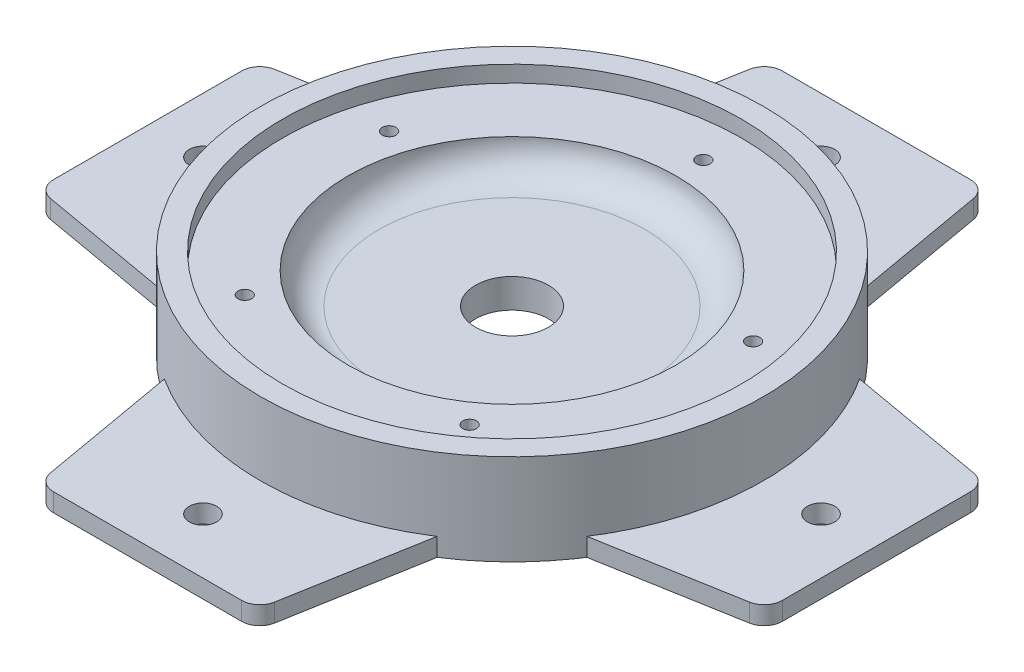
from build123d import *

# Parameters (mm, degrees)
F_3_16_0_1865_DIAMETER_HOLE1_AT_2_COUNT = 2
F_3_16_0_1865_DIAMETER_HOLE1_AT_2_PITCH = 181.676687383
CIRPATTERN2_COUNT                       = 5
F_1_1_DIAMETER_HOLE1_D                  = 25.4
BOSS_EXTRUDE1_DEPTH                     = 6.35
FILLET2_R                               = 6.35
CIRPATTERN4_COUNT                       = 4
FILLET3_R                               = 10.795


with BuildPart() as part:
    # Sketch1 → Revolve1 (revolve)
    with BuildSketch(Plane.XY, mode=Mode.PRIVATE) as revolve1_sk:
        Polygon((87.63, -5.08), (87.63, 26.67), (79.9719, 26.67), (79.9719, 20.955), (57.15, 20.955), (57.15, 10.16), (0, 10.16), (0, 0), (57.15, 0), (57.15, -5.08), align=None)
    revolve(revolve1_sk.sketch.rotate(Axis((0, 92.596818824, 0), (0, -1, 0)), 90), axis=Axis((0, 92.596818824, 0), (0, -1, 0)))

    # Sketch6 → 3/16 (0.1865) Diameter Hole1 (revolve, cut)
    with BuildSketch(Plane(origin=(0, 26.67, -66.675), x_dir=(0, 0, 1), z_dir=(1, 0, 0))):
        Polygon((0, 0), (0, 11.075168419), (2.36855, 9.652), (2.36855, 0), align=None)
    f_3_16_0_1865_diameter_hole1 = revolve(axis=Axis((0, 33.02, -66.675), (0, -1, 0)), mode=Mode.SUBTRACT)

    # 3/16 (0.1865) Diameter Hole1 at 2: 3/16 (0.1865) Diameter Hole1 ×2
    with Locations(*[Vector(-0.6277965872660483, 0, 0.778377443800309) * (i * F_3_16_0_1865_DIAMETER_HOLE1_AT_2_PITCH) for i in range(1, F_3_16_0_1865_DIAMETER_HOLE1_AT_2_COUNT)]):
        add(f_3_16_0_1865_diameter_hole1, mode=Mode.SUBTRACT)

    # CirPattern2: 3/16 (0.1865) Diameter Hole1 ×5 about axis
    cirpattern2_axis = Axis((0, 0, 0), (0, 1, 0))
    for i in range(1, CIRPATTERN2_COUNT):
        add(f_3_16_0_1865_diameter_hole1.rotate(cirpattern2_axis, i * 360 / CIRPATTERN2_COUNT), mode=Mode.SUBTRACT)

    # CirPattern2 copy 1 sketch → CirPattern2 copy 1 (revolve, cut)
    with BuildSketch(Plane(origin=(35.834852053, 26.67, 131.569029239), x_dir=(0.9510565162951535, 0, 0.30901699437494745), z_dir=(0.30901699437494745, 0, -0.9510565162951535))):
        Polygon((0, 0), (0, 11.075168419), (2.36855, 9.652), (2.36855, 0), align=None)
    revolve(axis=Axis((35.834852053, 33.02, 131.569029239), (0, -1, 0)), mode=Mode.SUBTRACT)

    # CirPattern2 copy 2 sketch → CirPattern2 copy 2 (revolve, cut)
    with BuildSketch(Plane(origin=(136.203160876, 26.67, 6.576096413), x_dir=(0.5877852522924732, 0, -0.8090169943749473), z_dir=(-0.8090169943749473, 0, -0.5877852522924732))):
        Polygon((0, 0), (0, 11.075168419), (2.36855, 9.652), (2.36855, 0), align=None)
    revolve(axis=Axis((136.203160876, 33.02, 6.576096413), (0, -1, 0)), mode=Mode.SUBTRACT)

    # CirPattern2 copy 3 sketch → CirPattern2 copy 3 (revolve, cut)
    with BuildSketch(Plane(origin=(48.343330743, 26.67, -127.504778142), x_dir=(-0.587785252292473, 0, -0.8090169943749476), z_dir=(-0.8090169943749476, 0, 0.587785252292473))):
        Polygon((0, 0), (0, 11.075168419), (2.36855, 9.652), (2.36855, 0), align=None)
    revolve(axis=Axis((48.343330743, 33.02, -127.504778142), (0, -1, 0)), mode=Mode.SUBTRACT)

    # CirPattern2 copy 4 sketch → CirPattern2 copy 4 (revolve, cut)
    with BuildSketch(Plane(origin=(-106.325339347, 26.67, -85.378383033), x_dir=(-0.9510565162951536, 0, 0.30901699437494723), z_dir=(0.30901699437494723, 0, 0.9510565162951536))):
        Polygon((0, 0), (0, 11.075168419), (2.36855, 9.652), (2.36855, 0), align=None)
    revolve(axis=Axis((-106.325339347, 33.02, -85.378383033), (0, -1, 0)), mode=Mode.SUBTRACT)

    # 1 (1) Diameter Hole1 (through all)
    with Locations(Plane(origin=(0, 10.16, 0), x_dir=(1, 0, 0), z_dir=(0, 1, 0))):
        with Locations((0, 0)):
            Hole(F_1_1_DIAMETER_HOLE1_D / 2)

    # Fillet3
    # the kernel refuses this fillet: 10.795 mm, written as the material it adds along each edge
    with BuildSketch(Plane(origin=(0, 10.16, 0), x_dir=(0, 0, 1), z_dir=(1, 0, 0))) as fillet3_piece_1:
        with BuildLine():
            CenterArc((57.15 - FILLET3_R, -FILLET3_R), FILLET3_R, 0, 90)
            Line((57.15 - FILLET3_R, 0), (57.15 - FILLET3_R, FILLET3_R * 0.02))
            Line((57.15 - FILLET3_R, FILLET3_R * 0.02), (57.15 + FILLET3_R * 0.02, FILLET3_R * 0.02))
            Line((57.15 + FILLET3_R * 0.02, FILLET3_R * 0.02), (57.15 + FILLET3_R * 0.02, -FILLET3_R))
            Line((57.15 + FILLET3_R * 0.02, -FILLET3_R), (57.15, -FILLET3_R))
        make_face()
    revolve(axis=Axis((0, 10.16, 0), (0, -1, 0)))
    with BuildSketch(Plane(origin=(0, 0, 0), x_dir=(0, 0, 1), z_dir=(1, 0, 0))) as fillet3_piece_2:
        with BuildLine():
            CenterArc((47.99189976, 10.795), FILLET3_R, 270, 58.034281249)
            Line((47.99189976, 0), (47.99189976, -0.2159))
            Line((47.99189976, -0.2159), (57.15, -0.2159))
            Line((57.15, -0.2159), (57.3659, 0))
            ThreePointArc((57.3659, 0), (57.3659, 2.54), (57.333162005, 4.9657))
            Line((57.333162005, 4.9657), (57.15, 5.08))
        make_face()
    revolve(axis=Axis((0, 0, 0), (0, -1, 0)))


with BuildPart() as body_2:
    # Sketch15 → Boss-Extrude1 (new body)
    with BuildSketch(Plane.XZ.offset(5.08)):
        with BuildLine():
            Line((-127, -38.1), (-73.632954963, -47.510049921))
            ThreePointArc((-73.632954963, -47.510049921), (-87.63, 0), (-73.632954963, 47.510049921))
            Line((-73.632954963, 47.510049921), (-127, 38.1))
            Line((-127, 38.1), (-127, -38.1))
        make_face()
    extrude(amount=-BOSS_EXTRUDE1_DEPTH)

    # Fillet2
    fillet2_edges = [body_2.edges().sort_by_distance(p)[0] for p in [
        (-127, -1.905, 38.1),
        (-127, -1.905, -38.1),
    ]]
    fillet(fillet2_edges, radius=FILLET2_R)

    # Sketch17 → 3/8 (0.375) Diameter Hole1 (revolve, cut)
    with BuildSketch(Plane(origin=(-107.696, 1.27, 0), x_dir=(0, 0, 1), z_dir=(1, 0, 0))):
        Polygon((0, 0), (0, 28.261598698), (4.7625, 25.4), (4.7625, 0), align=None)
    revolve(axis=Axis((-107.696, 7.62, 0), (0, -1, 0)), mode=Mode.SUBTRACT)


with BuildPart() as cirpattern4_1:
    # CirPattern4: pattern copy
    add(body_2.part.rotate(Axis((0, 0, 0), (0, 1, 0)), 1 * 360 / CIRPATTERN4_COUNT))


with BuildPart() as cirpattern4_2:
    # CirPattern4: pattern copy
    add(body_2.part.rotate(Axis((0, 0, 0), (0, 1, 0)), 2 * 360 / CIRPATTERN4_COUNT))


with BuildPart() as cirpattern4_3:
    # CirPattern4: pattern copy
    add(body_2.part.rotate(Axis((0, 0, 0), (0, 1, 0)), 3 * 360 / CIRPATTERN4_COUNT))


solid = Compound([part.part, body_2.part, cirpattern4_1.part, cirpattern4_2.part, cirpattern4_3.part])
